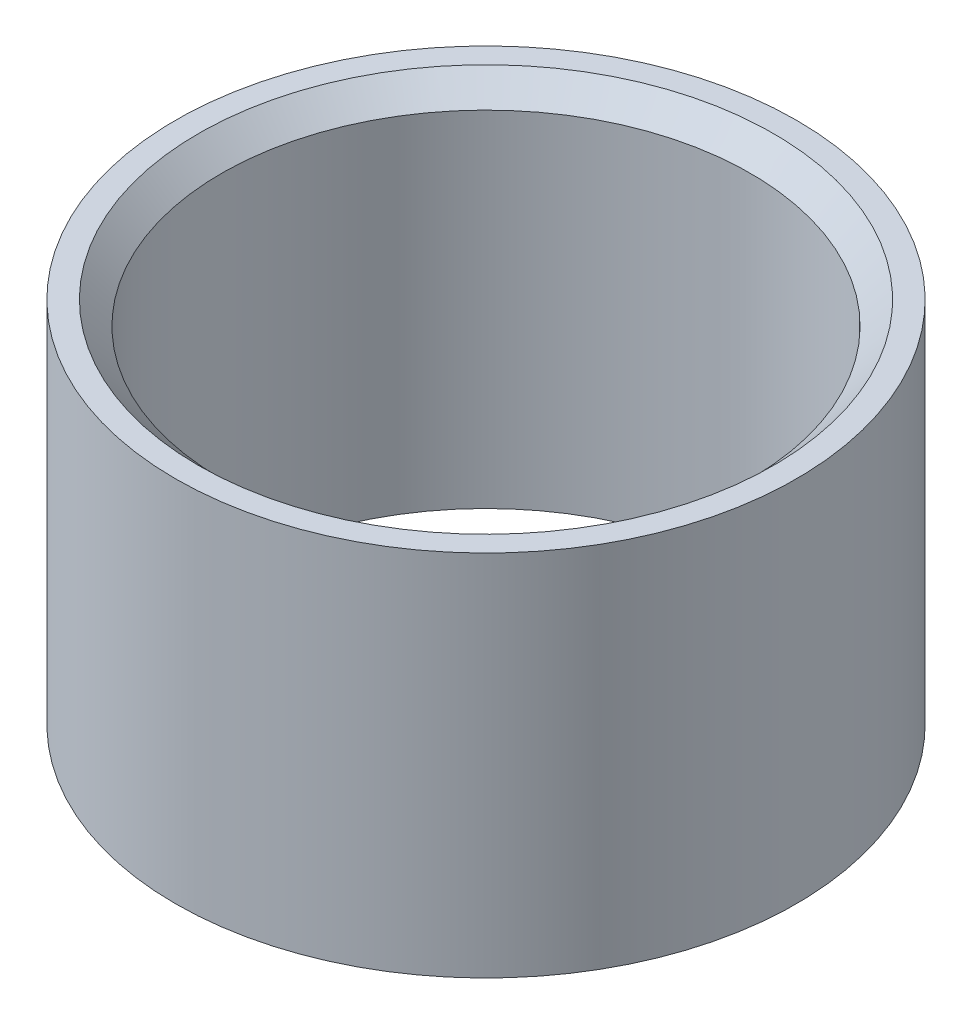
from build123d import *

# Parameters (mm, degrees)
SKETCH1_R           = 1.35
BOSS_EXTRUDE1_DEPTH = 1.6
SKETCH2_R           = 1.15
CUT_EXTRUDE1_DEPTH  = 3.490983741
CHAMFER1_SIZE       = 0.1


with BuildPart() as part:
    # Sketch1 → Boss-Extrude1 (new body)
    with BuildSketch(Plane(origin=(0, 0, 0), x_dir=(1, 0, 0), z_dir=(0, 1, 0))):
        Circle(SKETCH1_R)
    extrude(amount=BOSS_EXTRUDE1_DEPTH)

    # Sketch2 → Cut-Extrude1 (cut, through all)
    with BuildSketch(Plane(origin=(0, 1.6, 0), x_dir=(1, 0, 0), z_dir=(0, 1, 0))):
        Circle(SKETCH2_R)
    extrude(amount=-CUT_EXTRUDE1_DEPTH, mode=Mode.SUBTRACT)

    # Chamfer1
    chamfer1_edges = [part.edges().sort_by_distance(p)[0] for p in [
        (-1.15, 1.6, 0),
    ]]
    chamfer(chamfer1_edges, length=CHAMFER1_SIZE)


solid = part.part
